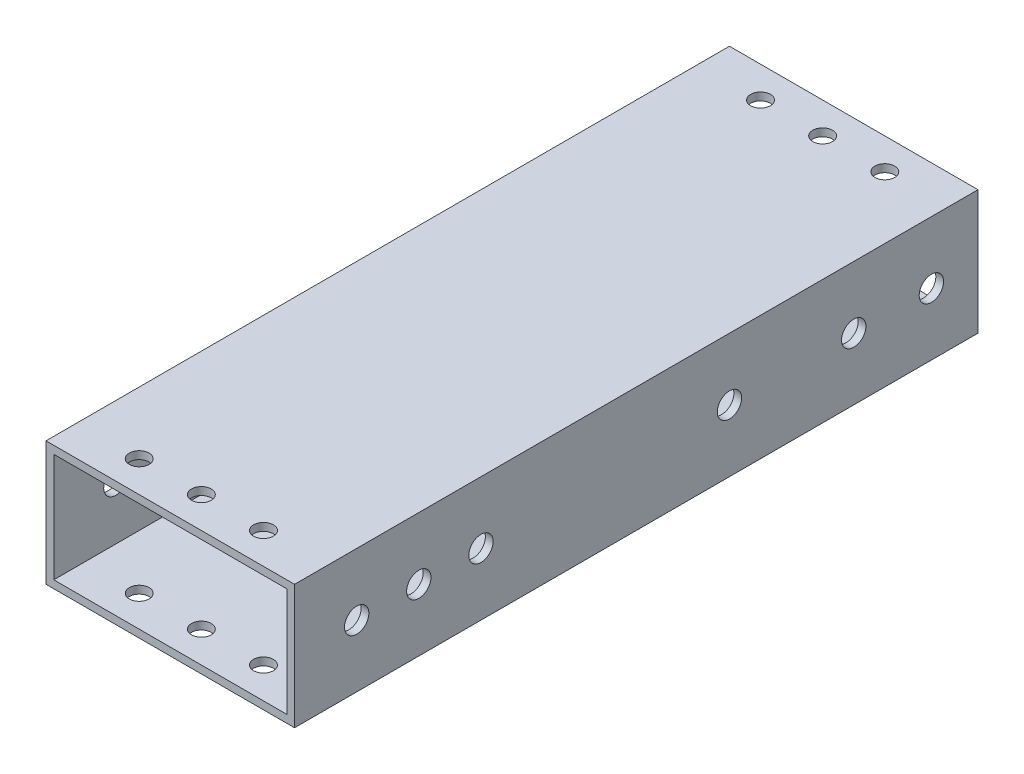
from build123d import *

# Parameters (mm, degrees)
SKETCH1_W           = 50.8
SKETCH1_H           = 25.4
SKETCH1_W_2         = 47.625
SKETCH1_H_2         = 22.225
BOSS_EXTRUDE1_DEPTH = 69.85
SKETCH2_R           = 2.0193
CUT_EXTRUDE1_DEPTH  = 79.545162168
SKETCH3_R           = 2.4892
CUT_EXTRUDE2_DEPTH  = 88.298066989


with BuildPart() as part:
    # Sketch1 → Boss-Extrude1 (new, symmetric)
    with BuildSketch(Plane.XY):
        Rectangle(SKETCH1_W, SKETCH1_H)
        Rectangle(SKETCH1_W_2, SKETCH1_H_2, mode=Mode.SUBTRACT)
    extrude(amount=BOSS_EXTRUDE1_DEPTH, both=True)

    # Sketch2 → Cut-Extrude1 (cut, through all)
    with BuildSketch(Plane(origin=(0, 12.7, 0), x_dir=(1, 0, 0), z_dir=(0, 1, 0))):
        with Locations((-12.7, 63.5)):
            Circle(SKETCH2_R)
        with Locations((0, 63.5)):
            Circle(SKETCH2_R)
        with Locations((12.7, 63.5)):
            Circle(SKETCH2_R)
        with Locations((12.7, -63.5)):
            Circle(SKETCH2_R)
        with Locations((0, -63.5)):
            Circle(SKETCH2_R)
        with Locations((-12.7, -63.5)):
            Circle(SKETCH2_R)
    extrude(amount=-CUT_EXTRUDE1_DEPTH, mode=Mode.SUBTRACT)

    # Sketch3 → Cut-Extrude2 (cut, through all)
    with BuildSketch(Plane(origin=(25.4, 0, 0), x_dir=(0, 0, -1), z_dir=(1, 0, 0))):
        with Locations((-57.15, 0)):
            Circle(SKETCH3_R)
        with Locations((-44.45, 0)):
            Circle(SKETCH3_R)
        with Locations((-31.75, 0)):
            Circle(SKETCH3_R)
        with Locations((60.325, 0)):
            Circle(SKETCH3_R)
        with Locations((44.45, 0)):
            Circle(SKETCH3_R)
        with Locations((19.05, 0)):
            Circle(SKETCH3_R)
    extrude(amount=-CUT_EXTRUDE2_DEPTH, mode=Mode.SUBTRACT)


solid = part.part
